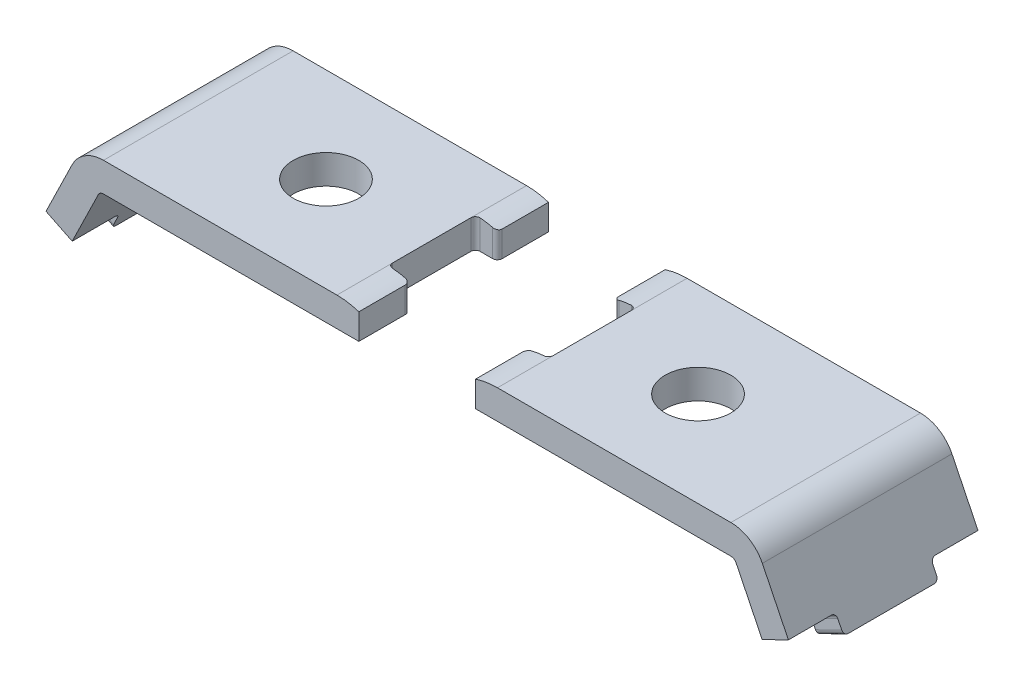
from build123d import *

# Parameters (mm, degrees)
BOSS_EXTRUDE1_DEPTH      = 20.6375
BOSS_EXTRUDE1_DEPTH_BACK = 20.6375
SKETCH6_R                = 7.14375
SKETCH6_W                = 4.7752
SKETCH6_H                = 19.05
CUT_EXTRUDE1_DEPTH       = 88.945207551
SKETCH7_W                = 10.3124
SKETCH7_H                = 3.9624
CUT_EXTRUDE_3_DEPTH      = 767.15686601
FILLET1_R                = 1.016


with BuildPart() as part:
    # Sketch5 → Boss-Extrude1 (new, two sides: drawn at the far end of the back side and taken through both)
    with BuildSketch(Plane.XY.offset(-BOSS_EXTRUDE1_DEPTH_BACK)):
        with BuildLine():
            Line((-17.4752, 6.35), (-68.293230581, 6.35))
            ThreePointArc((-68.293230581, 6.35), (-72.328570401, 5.193778503), (-75.139304801, 2.075992792))
            Line((-75.139304801, 2.075992792), (-82.55, -13.086672673))
            Line((-82.55, -13.086672673), (-76.844938149, -15.875))
            Line((-76.844938149, -15.875), (-69.434242951, -0.712334535))
            ThreePointArc((-69.434242951, -0.712334535), (-68.965787217, -0.192703583), (-68.293230581, 0))
            Line((-68.293230581, 0), (-12.7, 0))
            Line((-12.7, 0), (-12.7, 5.588))
            ThreePointArc((-12.7, 5.588), (-15.057392158, 6.158302475), (-17.4752, 6.35))
        make_face()
    extrude(amount=BOSS_EXTRUDE1_DEPTH + BOSS_EXTRUDE1_DEPTH_BACK)

    # Sketch6 → Cut-Extrude1 (cut, through all)
    with BuildSketch(Plane(origin=(0, 6.35, 0), x_dir=(1, 0, 0), z_dir=(0, 1, 0))):
        with Locations(Location((-40.49395, 0, 0), (0, 0, 180))):
            Circle(SKETCH6_R)
        with Locations((-15.0876, 0)):
            Rectangle(SKETCH6_W, SKETCH6_H)
    extrude(amount=-CUT_EXTRUDE1_DEPTH, mode=Mode.SUBTRACT)

    # Sketch7 → Cut-Extrude 3 (cut, through all)
    with BuildSketch(Plane(origin=(-396.872635609, -656.207033754, 0), x_dir=(0, 0, 1), z_dir=(0.8984349370992722, -0.4391066656285541, 0))):
        with Locations((15.4813, -717.804165609)):
            Rectangle(SKETCH7_W, SKETCH7_H)
        with Locations((-15.4813, -717.804165609)):
            Rectangle(SKETCH7_W, SKETCH7_H)
    extrude(amount=CUT_EXTRUDE_3_DEPTH, mode=Mode.SUBTRACT)

    # Fillet1
    # the kernel refuses this fillet: 1.016 mm, written as the material it adds along each edge
    with BuildSketch(Plane(origin=(-17.4752, 8.89, -9.525), x_dir=(0, 0, 1), z_dir=(0, -1, 0))) as fillet1_piece_1_section:
        with BuildLine():
            CenterArc((FILLET1_R, -FILLET1_R), FILLET1_R, 90, 90)
            Line((0, -FILLET1_R), (0, 0))
            Line((0, 0), (FILLET1_R, 0))
        make_face()
    fillet1_piece_1 = extrude(amount=8.89, mode=Mode.PRIVATE)
    fillet1_piece_1 = fillet1_piece_1 & Plane(origin=(-17.4752, -8.993293333, -9.297995712), x_dir=(0.31122392671890353, 0.9503366074384731, 0), z_dir=(0, 0, -1)) * Cylinder(15.343293333, 22, mode=Mode.PRIVATE)
    add(fillet1_piece_1)
    with BuildSketch(Plane(origin=(-17.4752, 8.89, 9.525), x_dir=(1, 0, 0), z_dir=(0, -1, 0))) as fillet1_piece_2_section:
        with BuildLine():
            CenterArc((FILLET1_R, -FILLET1_R), FILLET1_R, 90, 90)
            Line((0, -FILLET1_R), (0, 0))
            Line((0, 0), (FILLET1_R, 0))
        make_face()
    fillet1_piece_2 = extrude(amount=8.89, mode=Mode.PRIVATE)
    fillet1_piece_2 = fillet1_piece_2 & Plane(origin=(-17.4752, -8.993293333, 9.29799564), x_dir=(0.31122392671890353, 0.9503366074384731, 0), z_dir=(0, 0, -1)) * Cylinder(15.343293333, 22, mode=Mode.PRIVATE)
    add(fillet1_piece_2)
    with BuildSketch(Plane(origin=(-80.810083748, -9.526714078, 10.3251), x_dir=(0, 0, 1), z_dir=(0.8984349370992722, -0.4391066656285541, 0))) as fillet1_piece_3:
        with BuildLine():
            CenterArc((FILLET1_R, FILLET1_R), FILLET1_R, 180, 90)
            Line((0, FILLET1_R), (0, 0))
            Line((0, 0), (FILLET1_R, 0))
        make_face()
    extrude(amount=6.35)
    with BuildSketch(Plane(origin=(-80.810083748, -9.526714078, -10.3251), x_dir=(0, 0, -1), z_dir=(0.8984349370992722, -0.4391066656285541, 0))) as fillet1_piece_4:
        with BuildLine():
            CenterArc((FILLET1_R, -FILLET1_R), FILLET1_R, 90, 90)
            Line((0, -FILLET1_R), (0, 0))
            Line((0, 0), (FILLET1_R, 0))
        make_face()
    extrude(amount=6.35)
    # the kernel refuses this fillet: 1.016 mm, written as the material it takes off along each edge
    with BuildSketch(Plane(origin=(-12.7, 8.128, -9.525), x_dir=(0, 0, -1), z_dir=(0, -1, 0)), Plane(origin=(-12.7, 8.128, 9.525), x_dir=(-1, 0, 0), z_dir=(0, -1, 0))) as fillet1_2_piece_1:
        with BuildLine():
            CenterArc((FILLET1_R, -FILLET1_R), FILLET1_R, 90, 90)
            Line((0, -FILLET1_R), (0, 0))
            Line((0, 0), (FILLET1_R, 0))
        make_face()
    extrude(amount=10.668, mode=Mode.SUBTRACT)
    with BuildSketch(Plane(origin=(-84.83202474, -11.971341743, 10.3251), x_dir=(0, 0, -1), z_dir=(0.8984349370992722, -0.4391066656285541, 0)), Plane(origin=(-84.83202474, -11.971341743, -10.3251), x_dir=(0.43910666562855405, 0.8984349370992722, 0), z_dir=(0.8984349370992722, -0.4391066656285541, 0))) as fillet1_2_piece_2:
        with BuildLine():
            CenterArc((FILLET1_R, FILLET1_R), FILLET1_R, 180, 90)
            Line((0, FILLET1_R), (0, 0))
            Line((0, 0), (FILLET1_R, 0))
        make_face()
    extrude(amount=11.43, mode=Mode.SUBTRACT)


with BuildPart() as body_2:
    # Mirror4: mirrored copy
    add(part.part.mirror(Plane(origin=(0, 0, 0), x_dir=(0, 0, 1), z_dir=(1, 0, 0))))


solid = Compound([part.part, body_2.part])
